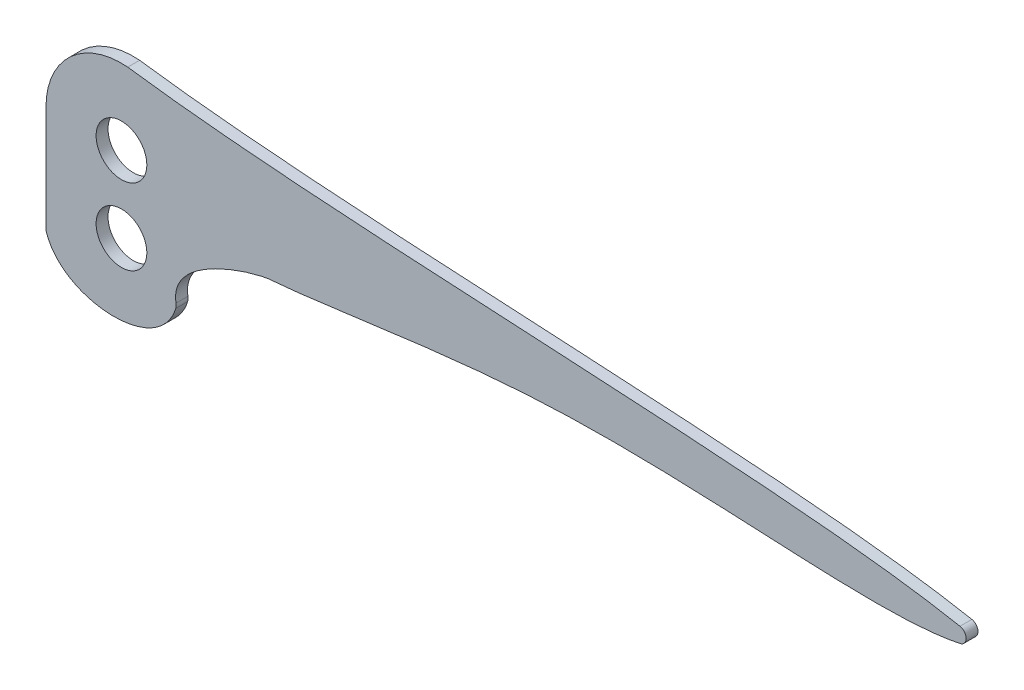
from build123d import *

# Parameters (mm, degrees)
SKETCH1_R           = 8.466666667
BOSS_EXTRUDE1_DEPTH = 3.96875
SCALE1_SCALE        = 0.75


with BuildPart() as part:
    # Sketch1 → Boss-Extrude1 (new body)
    with BuildSketch(Plane.XY):
        with BuildLine():
            ThreePointArc((2.090204907, 25.105012471), (-17.058347301, 18.537621075), (-25.191875828, 0))
            Line((-25.191875828, 0), (-25.191875828, -35.215356132))
            ThreePointArc((-25.191875828, -35.215356132), (-25.144594979, -35.781140778), (-25.004063999, -36.331230578))
            add(Edge.make_bspline(
                [(-25.004063999, -36.331230578), (-24.302161584, -38.357321078), (-17.500345693, -49.472928078), (6.486565439, -52.353017034), (16.828257208, -40.890808587), (18.117618202, -36.640731795)],
                knots=[0.011286064, 0.011286064, 0.011286064, 0.011286064, 0.130987572, 0.750185474, 0.983991621, 0.983991621, 0.983991621, 0.983991621], degree=3))
            ThreePointArc((18.117618202, -36.640731795), (18.258374718, -35.854153527), (18.212152653, -35.056418427))
            add(Edge.make_bspline(
                [(18.212152653, -35.056418427), (15.722327617, -21.003254002), (45.083704914, -12.577387864), (50.314621311, -12.487786805)],
                knots=[0.243688719, 0.243688719, 0.243688719, 0.243688719, 1, 1, 1, 1], degree=3))
            add(Edge.make_bspline(
                [(50.314621311, -12.487786805), (67.828969762, -11.217353563), (162.851239243, 6.097445829), (250.038282618, -9.041784468), (279.934807735, -2.602592093)],
                knots=[0.23584572, 0.23584572, 0.23584572, 0.23584572, 0.495200792, 0.941477437, 0.941477437, 0.941477437, 0.941477437], degree=3))
            ThreePointArc((279.934807735, -2.602592093), (281.939894054, -0.09633433), (279.889362488, 2.372880002))
            add(Edge.make_bspline(
                [(2.090204907, 25.105012471), (29.372633882, 21.318909318), (128.041674084, 14.540572725), (239.548411309, 10.293455518), (279.889362488, 2.372880002)],
                knots=[0.008543469, 0.008543469, 0.008543469, 0.008543469, 0.340594684, 0.94139515, 0.94139515, 0.94139515, 0.94139515], degree=3))
        make_face()
        with Locations((0, -25.4)):
            Circle(SKETCH1_R, mode=Mode.SUBTRACT)
        Circle(SKETCH1_R, mode=Mode.SUBTRACT)
    extrude(amount=BOSS_EXTRUDE1_DEPTH)


with BuildPart() as part_1:
    # Scale1: scaled about (77.999855218, -1.358061802, 1.984375)
    add(part.part.scale(SCALE1_SCALE).moved(Location((19.499963804, -0.33951545, 0.49609375))))


solid = part_1.part
